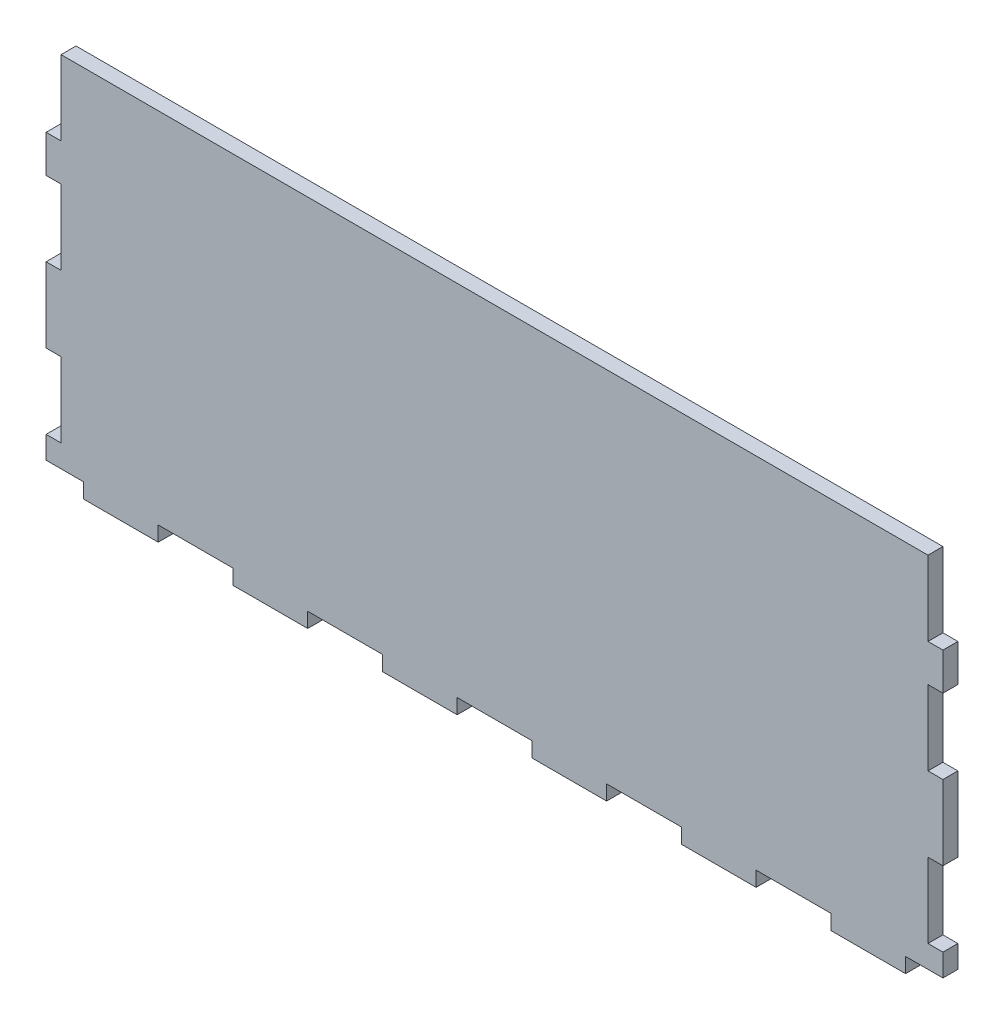
from build123d import *

# Parameters (mm, degrees)
BOSS_EXTRUDE1_DEPTH = 2.54


with BuildPart() as part:
    # Sketch1 → Boss-Extrude1 (new, symmetric)
    with BuildSketch(Plane.XY):
        Polygon((147.32, 0), (-147.32, 0), (-147.32, -25.4), (-152.4, -25.4), (-152.4, -38.1), (-147.32, -38.1), (-147.32, -63.5), (-152.4, -63.5), (-152.4, -88.9), (-147.32, -88.9), (-147.32, -114.3), (-152.4, -114.3), (-152.4, -121.92), (-139.7, -121.92), (-139.7, -127), (-114.3, -127), (-114.3, -121.92), (-88.9, -121.92), (-88.9, -127), (-63.5, -127), (-63.5, -121.92), (-38.1, -121.92), (-38.1, -127), (-12.7, -127), (-12.7, -121.92), (12.7, -121.92), (12.7, -127), (38.1, -127), (38.1, -121.92), (63.5, -121.92), (63.5, -127), (88.9, -127), (88.9, -121.92), (114.3, -121.92), (114.3, -127), (139.7, -127), (139.7, -121.92), (152.4, -121.92), (152.4, -114.3), (147.32, -114.3), (147.32, -88.9), (152.4, -88.9), (152.4, -63.5), (147.32, -63.5), (147.32, -38.1), (152.4, -38.1), (152.4, -25.4), (147.32, -25.4), align=None)
    extrude(amount=BOSS_EXTRUDE1_DEPTH, both=True)


solid = part.part
